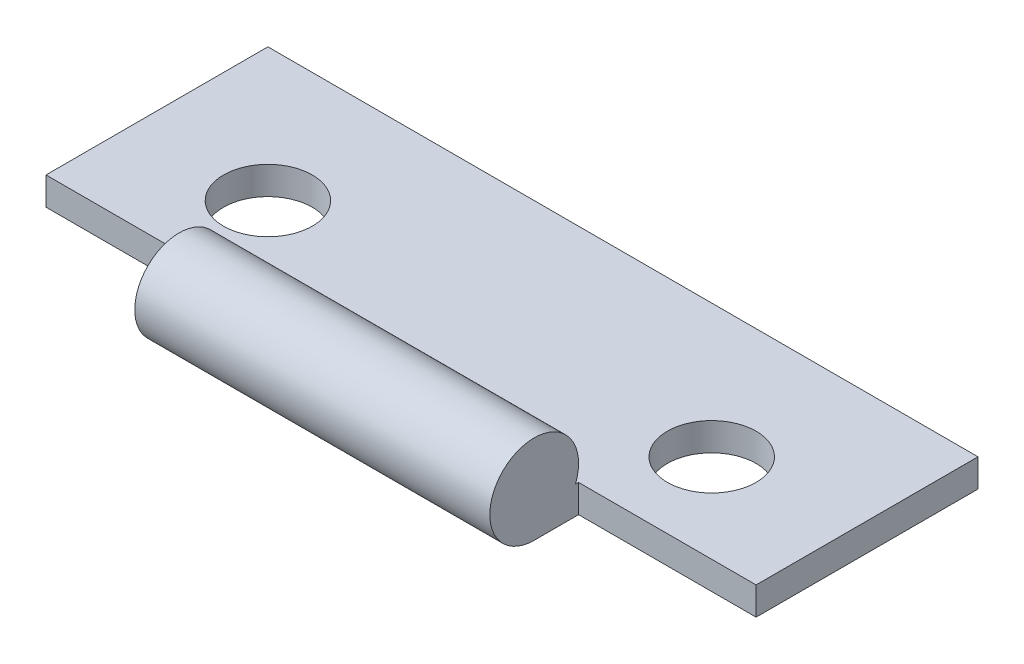
from build123d import *

# Parameters (mm, degrees)
SKETCH1_R           = 1.5875
BOSS_EXTRUDE1_DEPTH = 1
SKETCH2_R           = 1.5875
BOSS_EXTRUDE2_DEPTH = 12.7


with BuildPart() as part:
    # Sketch1 → Boss-Extrude1 (new body)
    with BuildSketch(Plane(origin=(0, 0, 0), x_dir=(1, 0, 0), z_dir=(0, 1, 0))):
        Polygon((25.4, 9.525), (25.4, 1.5875), (19.05, 1.5875), (19.05, 0), (6.35, 0), (6.35, 1.5875), (0, 1.5875), (0, 9.525), align=None)
        with Locations((4.7625, 4.7625)):
            Circle(SKETCH1_R, mode=Mode.SUBTRACT)
        with Locations((20.6375, 4.7625)):
            Circle(SKETCH1_R, mode=Mode.SUBTRACT)
    extrude(amount=BOSS_EXTRUDE1_DEPTH)

    # Sketch2 → Boss-Extrude2 (add)
    with BuildSketch(Plane.ZY.offset(-6.35)):
        with Locations((0, 1.5875)):
            Circle(SKETCH2_R)
    extrude(amount=-BOSS_EXTRUDE2_DEPTH)


solid = part.part
